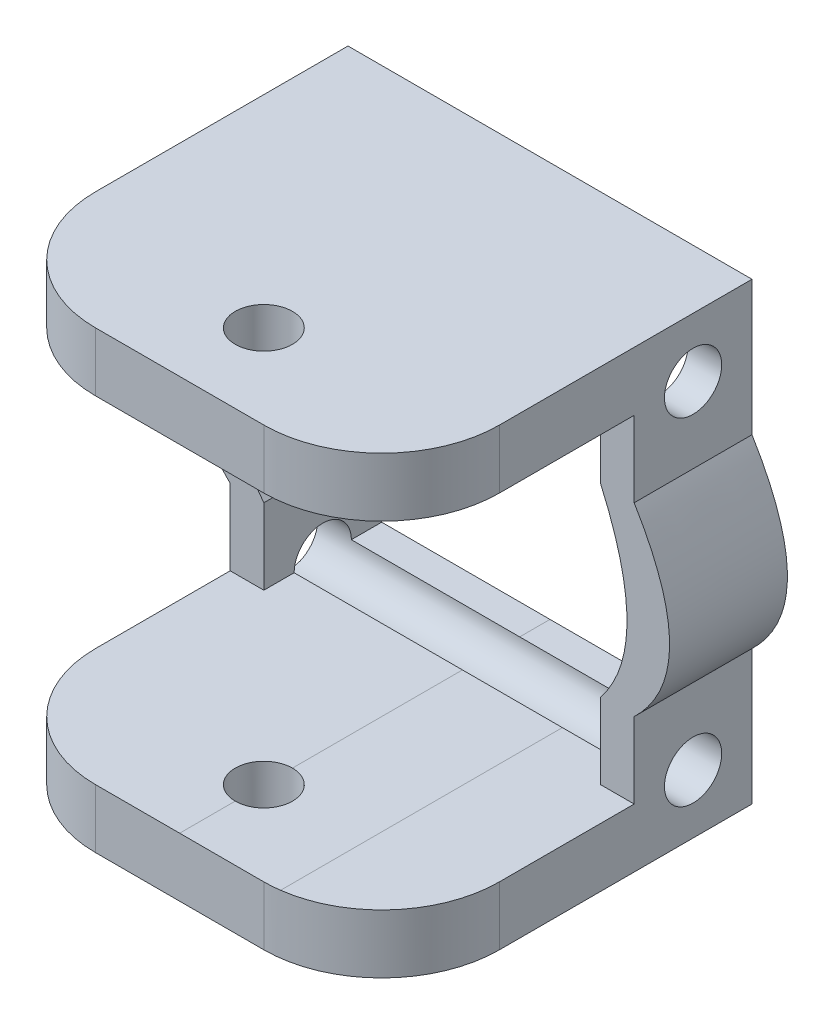
from build123d import *

# Parameters (mm, degrees)
SKETCH1_W               = 24
SKETCH1_H               = 3.5
BOSS_EXTRUDE1_DEPTH     = 7
BOSS_EXTRUDE2_START     = 7
BOSS_EXTRUDE2_OUTLINE_W = 24
BOSS_EXTRUDE2_OUTLINE_H = 3.5
BOSS_EXTRUDE2_DEPTH     = 15
FILLET1_R               = 7
M3_CLEARANCE_HOLE1_D    = 3.4
M3_CLEARANCE_HOLE2_D    = 3.4


# Read off the part's stored shape, not the designer's step: Boss-Extrude2
with BuildPart() as part:
    # Sketch1 → Boss-Extrude1 (new body)
    with BuildSketch(Plane.XY):
        with Locations((0, 11.75)):
            Rectangle(SKETCH1_W, SKETCH1_H)
        with BuildLine():
            Line((-10, 10), (-12, 10))
            Line((-12, 10), (-12, 5.5))
            add(Edge.make_bspline(
                [(-12, 5.5), (-16.208168435, -1.452739177), (-12, -5.5)],
                knots=[0, 0, 0, 0.703674115, 0.703674115, 0.703674115], degree=2))
            Line((-12, -5.5), (-12, -10))
            Line((-12, -10), (-10, -10))
            Line((-10, -10), (-10, -5.5))
            add(Edge.make_bspline(
                [(-10, 5.5), (-13.144989471, -1.593519523), (-10, -5.5)],
                knots=[0, 0, 0, 0.703674115, 0.703674115, 0.703674115], degree=2))
            Line((-10, 5.5), (-10, 10))
        make_face()
        with BuildLine():
            Line((12, 5.5), (12, 10))
            Line((12, 10), (10, 10))
            Line((10, 10), (10, 5.5))
            add(Edge.make_bspline(
                [(10, 5.5), (13.144989471, -1.593519523), (10, -5.5)],
                knots=[0, 0, 0, 0.703674115, 0.703674115, 0.703674115], degree=2))
            Line((10, -5.5), (10, -10))
            Line((10, -10), (12, -10))
            Line((12, -10), (12, -5.5))
            add(Edge.make_bspline(
                [(12, 5.5), (16.208168435, -1.452739177), (12, -5.5)],
                knots=[0, 0, 0, 0.703674115, 0.703674115, 0.703674115], degree=2))
        make_face()
        with BuildLine():
            Line((-10, -10), (-12, -10))
            Line((-12, -10), (-12, -13.5))
            Line((-12, -13.5), (12, -13.5))
            Line((12, -13.5), (12, -10))
            Line((12, -10), (10, -10))
            Line((10, -10), (5.934098246, -10))
            add(Edge.make_bspline(
                [(5.934098246, -10), (5.478588927, -10.00932896), (0, -10)],
                knots=[0.968742805, 0.968742805, 0.968742805, 1, 1, 1], degree=2))
            Line((0, -10), (-10, -10))
        make_face()
    extrude(amount=BOSS_EXTRUDE1_DEPTH)

    # Boss-Extrude2 outline → Boss-Extrude2 (add)
    with BuildSketch(Plane.XY.offset(BOSS_EXTRUDE2_START)):
        with BuildLine():
            Line((12, -10), (5.934098246, -10))
            add(Edge.make_bspline(
                [(5.934098246, -10), (5.478588927, -10.00932896), (0, -10)],
                knots=[0.968742805, 0.968742805, 0.968742805, 1, 1, 1], degree=2))
            Line((0, -10), (-12, -10))
            Line((-12, -10), (-12, -13.5))
            Line((-12, -13.5), (12, -13.5))
            Line((12, -13.5), (12, -10))
        make_face()
        with Locations((0, 11.75)):
            Rectangle(BOSS_EXTRUDE2_OUTLINE_W, BOSS_EXTRUDE2_OUTLINE_H)
    extrude(amount=BOSS_EXTRUDE2_DEPTH)

    # Fillet1
    fillet1_edges = [part.edges().sort_by_distance(p)[0] for p in [
        (12, -11.75, 22),
        (-12, -11.75, 22),
        (12, 11.75, 22),
        (-12, 11.75, 22),
    ]]
    fillet(fillet1_edges, radius=FILLET1_R)

    # M3 Clearance Hole1 (through all)
    with Locations(Plane.ZY.offset(12)):
        with Locations((3.5, 10), (3.5, -10)):
            Hole(M3_CLEARANCE_HOLE1_D / 2)

    # M3 Clearance Hole2 (through all)
    with Locations(Plane(origin=(0, 13.5, 0), x_dir=(1, 0, 0), z_dir=(0, 1, 0))):
        with Locations((0, -17)):
            Hole(M3_CLEARANCE_HOLE2_D / 2)


solid = part.part
